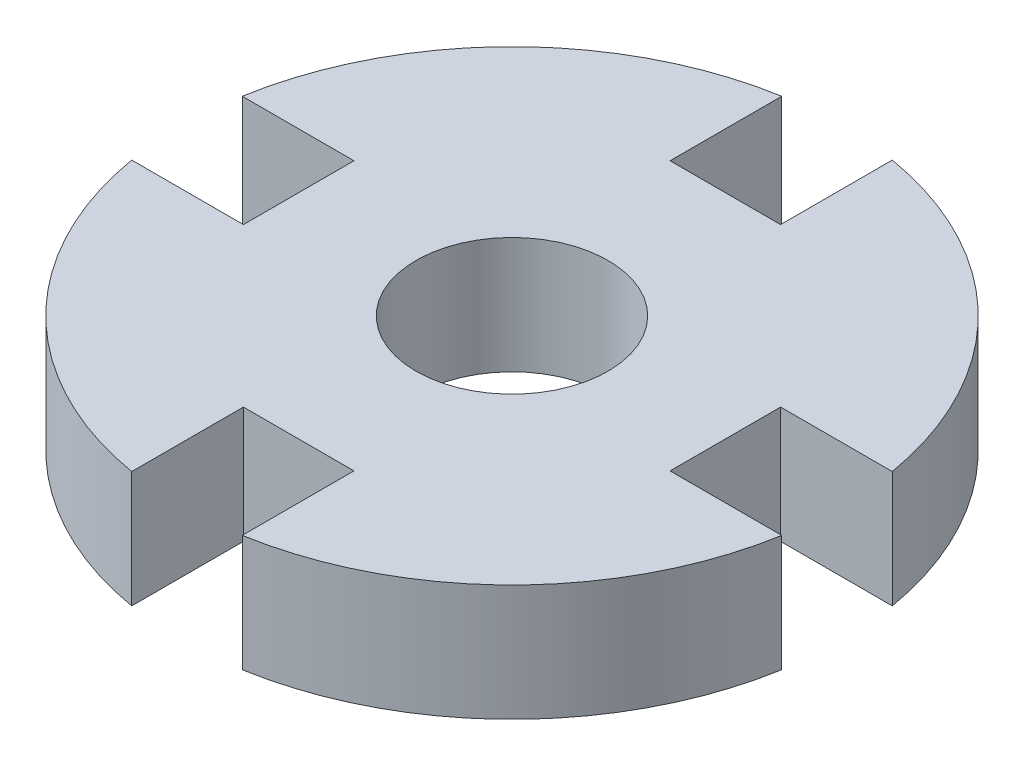
from build123d import *

# Parameters (mm, degrees)
BOSS_EXTRUDE1_DEPTH      = 1.5
BOSS_EXTRUDE1_DEPTH_BACK = 1.5
SKETCH1_R                = 8.5
SKETCH1_R_2              = 2.475
SKETCH2_W                = 3
SKETCH2_H                = 2.85
SKETCH2_W_2              = 2.85
SKETCH2_H_2              = 3
CUT_EXTRUDE1_DEPTH       = 13.389511693


with BuildPart() as part:
    # Sketch1 → Boss-Extrude1 (new, two sides: drawn at the far end of the back side and taken through both)
    with BuildSketch(Plane(origin=(0, 0, 0), x_dir=(1, 0, 0), z_dir=(0, 1, 0)).offset(-BOSS_EXTRUDE1_DEPTH_BACK)):
        Circle(SKETCH1_R)
        Circle(SKETCH1_R_2, mode=Mode.SUBTRACT)
    extrude(amount=BOSS_EXTRUDE1_DEPTH + BOSS_EXTRUDE1_DEPTH_BACK)

    # Sketch2 → Cut-Extrude1 (cut, through all)
    with BuildSketch(Plane(origin=(0, 1.5, 0), x_dir=(1, 0, 0), z_dir=(0, 1, 0))):
        with Locations((-7, 0)):
            Rectangle(SKETCH2_W, SKETCH2_H)
        with Locations((0, -7)):
            Rectangle(SKETCH2_W_2, SKETCH2_H_2)
        with Locations((0, 7)):
            Rectangle(SKETCH2_W_2, SKETCH2_H_2)
        with Locations((7, 0)):
            Rectangle(SKETCH2_W, SKETCH2_H)
    extrude(amount=-CUT_EXTRUDE1_DEPTH, mode=Mode.SUBTRACT)


solid = part.part
